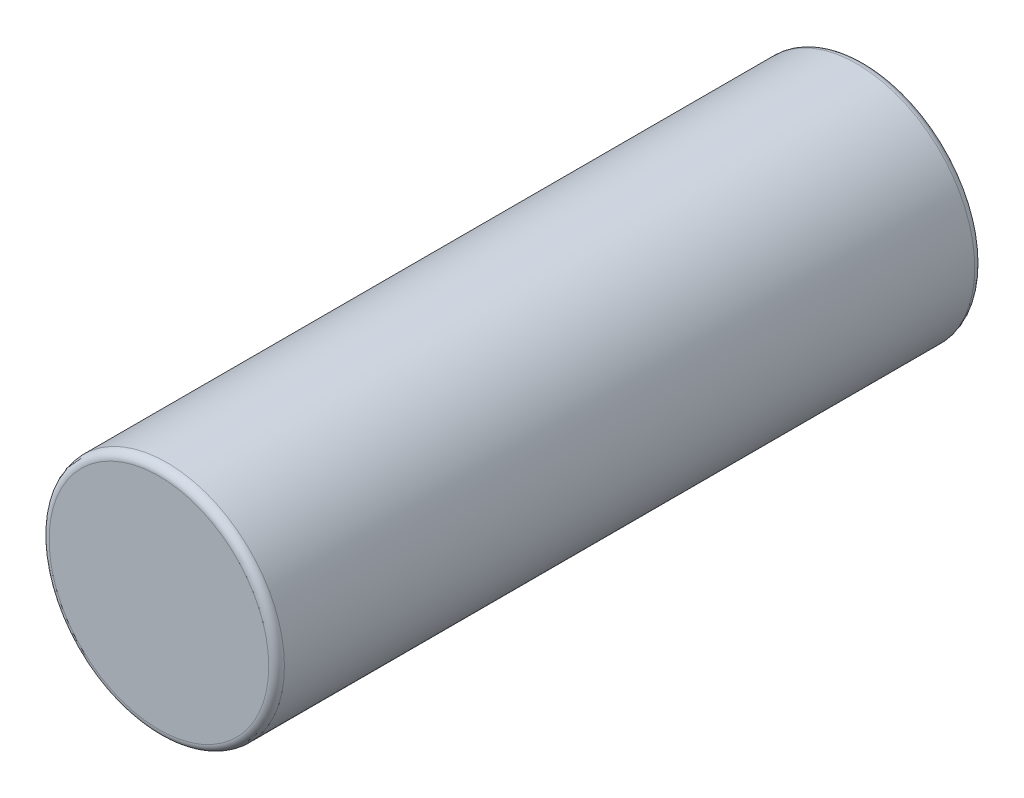
from build123d import *

# Parameters (mm, degrees)
SALIENTE_EXTRUIR1_DEPTH      = 2.25
SALIENTE_EXTRUIR1_DEPTH_BACK = 2.25
CROQUIS1_R                   = 0.75
REDONDEO1_R                  = 0.05


with BuildPart() as part:
    # Croquis1 → Saliente-Extruir1 (new, two sides: drawn at the far end of the back side and taken through both)
    with BuildSketch(Plane.XY.offset(-SALIENTE_EXTRUIR1_DEPTH_BACK)):
        Circle(CROQUIS1_R)
    extrude(amount=SALIENTE_EXTRUIR1_DEPTH + SALIENTE_EXTRUIR1_DEPTH_BACK)

    # Redondeo1
    redondeo1_edges = [part.edges().sort_by_distance(p)[0] for p in [
        (-0.75, 0, -2.25),
        (-0.75, 0, 2.25),
    ]]
    fillet(redondeo1_edges, radius=REDONDEO1_R)


solid = part.part
